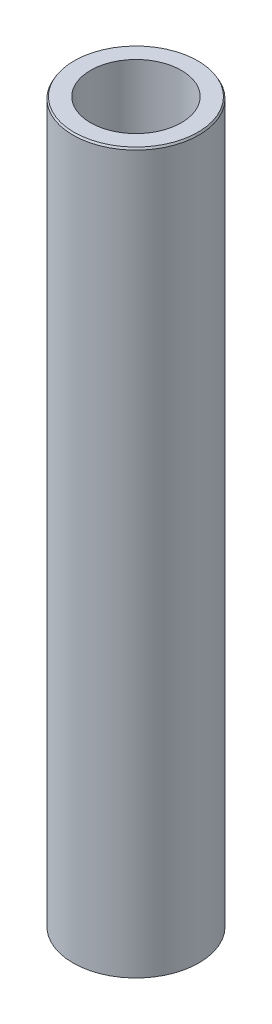
from build123d import *
from OCP.BRepFilletAPI import BRepFilletAPI_MakeChamfer

# Parameters (mm, degrees)
SKETCH1_R           = 52.5
BOSS_EXTRUDE1_DEPTH = 600
SKETCH2_R           = 37.859171618
CUT_EXTRUDE1_DEPTH  = 605.576297914
CHAMFER1_SIZE       = 1.573076527
CHAMFER1_SIZE2      = 0.908216156


with BuildPart() as part:
    # Sketch1 → Boss-Extrude1 (new body)
    with BuildSketch(Plane(origin=(0, 0, 0), x_dir=(1, 0, 0), z_dir=(0, 1, 0))):
        Circle(SKETCH1_R)
    extrude(amount=BOSS_EXTRUDE1_DEPTH)

    # Sketch2 → Cut-Extrude1 (cut, through all)
    with BuildSketch(Plane(origin=(0, 0, 0), x_dir=(1, 0, 0), z_dir=(0, 1, 0))):
        Circle(SKETCH2_R)
    extrude(amount=CUT_EXTRUDE1_DEPTH, mode=Mode.SUBTRACT)

    # Chamfer1: one chamfer whose edges measure the first distance from different faces: ONE call of the kernel's chamfer builder (chamfer() names one face for all edges)
    chamfer1_edges_1 = [part.edges().sort_by_distance(p)[0] for p in [
        (-52.5, 600, 0),
    ]]
    chamfer1_side_1 = [part.faces().sort_by_distance(p)[0] for p in [
        (-52.5, 300, 0),
    ]]
    chamfer1_edges_2 = [part.edges().sort_by_distance(p)[0] for p in [
        (-52.5, 0, 0),
    ]]
    chamfer1_side_2 = [part.faces().sort_by_distance(p)[0] for p in [
        (-51.01507576, 0, 0),
    ]]
    chamfer1 = BRepFilletAPI_MakeChamfer(part.part.solid().wrapped)
    for e in chamfer1_edges_1:
        chamfer1.Add(CHAMFER1_SIZE, CHAMFER1_SIZE2, e.wrapped, chamfer1_side_1[0].wrapped)  # the first distance lies on this face
    for e in chamfer1_edges_2:
        chamfer1.Add(CHAMFER1_SIZE, CHAMFER1_SIZE2, e.wrapped, chamfer1_side_2[0].wrapped)  # the first distance lies on this face
    add(Compound.cast(chamfer1.Shape()), mode=Mode.REPLACE)


solid = part.part
